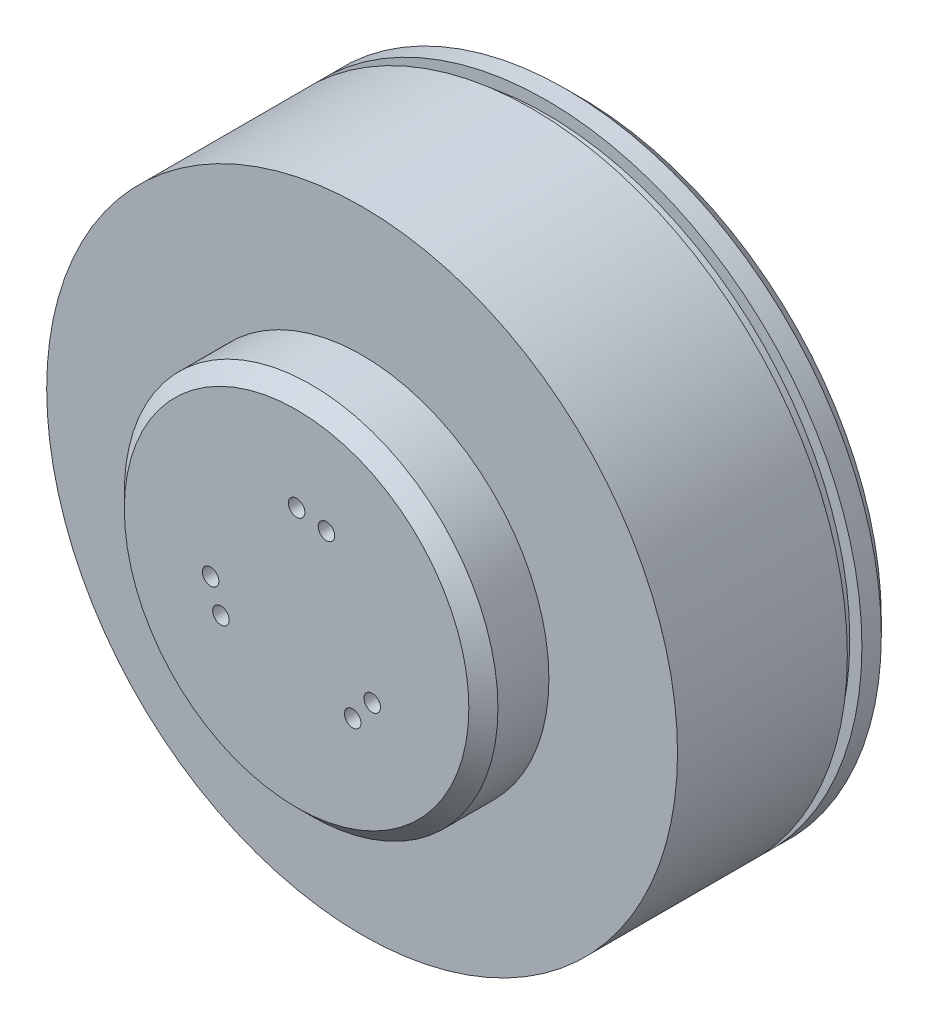
from build123d import *

# Parameters (mm, degrees)
BOSS_EXTRUDE1_START        = -120.0001
BOSS_EXTRUDE1_OUTLINE_R    = 130
BOSS_EXTRUDE1_DEPTH        = 90.0001
SKETCH2_R                  = 130
SKETCH2_R_2                = 125
CUT_EXTRUDE1_DEPTH         = 6
SKETCH3_R                  = 77
BOSS_EXTRUDE2_DEPTH        = 26.9999
M8X1_25_TAPPED_HOLE1_D     = 6.8
M8X1_25_TAPPED_HOLE1_DEPTH = 19.75
M8X1_25_TAPPED_HOLE1_TIP   = 2.042926105
CHAMFER1_SIZE              = 6
CHAMFER2_SIZE              = 6


# Read off the part's stored shape, not the designer's step: Boss-Extrude1
with BuildPart() as part:
    # Boss-Extrude1 outline → Boss-Extrude1 (new body)
    with BuildSketch(Plane(origin=(0, 0, -406.611081847), x_dir=(-1, 0, 0), z_dir=(0, 0, -1)).offset(BOSS_EXTRUDE1_START)):
        with Locations((34.426276825, 1.328199188)):
            Circle(BOSS_EXTRUDE1_OUTLINE_R)
    extrude(amount=BOSS_EXTRUDE1_DEPTH)

    # Sketch2 → Cut-Extrude1 (cut)
    with BuildSketch(Plane(origin=(0, 0, -356.611081847), x_dir=(-1, 0, 0), z_dir=(0, 0, -1))):
        with Locations((34.426276825, 1.328199188)):
            Circle(SKETCH2_R)
        with Locations((34.426276825, 1.328199188)):
            Circle(SKETCH2_R_2, mode=Mode.SUBTRACT)
    extrude(amount=CUT_EXTRUDE1_DEPTH, mode=Mode.SUBTRACT)

    # Sketch3 → Boss-Extrude2 (add)
    with BuildSketch(Plane.XY.offset(-286.610981847)):
        with Locations((-34.426276825, 1.328199188)):
            Circle(SKETCH3_R)
    extrude(amount=BOSS_EXTRUDE2_DEPTH)

    # M8x1.25 Tapped Hole1
    with Locations(Plane.XY.offset(-259.611081847)):
        with Locations((-34.426276825, 37.328199188), (-22.113551665, 35.157133536), (-3.249362288, -16.671800812), (-11.285922876, -26.249400764), (-65.603191361, -16.671800812), (-69.879355933, -4.923135208)):
            Hole(M8X1_25_TAPPED_HOLE1_D / 2, depth=M8X1_25_TAPPED_HOLE1_DEPTH)
            with Locations((0, 0, -(M8X1_25_TAPPED_HOLE1_DEPTH + M8X1_25_TAPPED_HOLE1_TIP / 2))):  # 118° drill point
                Cone(0, M8X1_25_TAPPED_HOLE1_D / 2, M8X1_25_TAPPED_HOLE1_TIP, mode=Mode.SUBTRACT)

    # Chamfer1
    chamfer1_edges = [part.edges().sort_by_distance(p)[0] for p in [
        (-111.426276825, 1.328199188, -259.611081847),
    ]]
    chamfer(chamfer1_edges, length=CHAMFER1_SIZE)

    # Chamfer2
    chamfer2_edges = [part.edges().sort_by_distance(p)[0] for p in [
        (95.573723175, 1.328199188, -376.611081847),
    ]]
    chamfer(chamfer2_edges, length=CHAMFER2_SIZE)


solid = part.part
